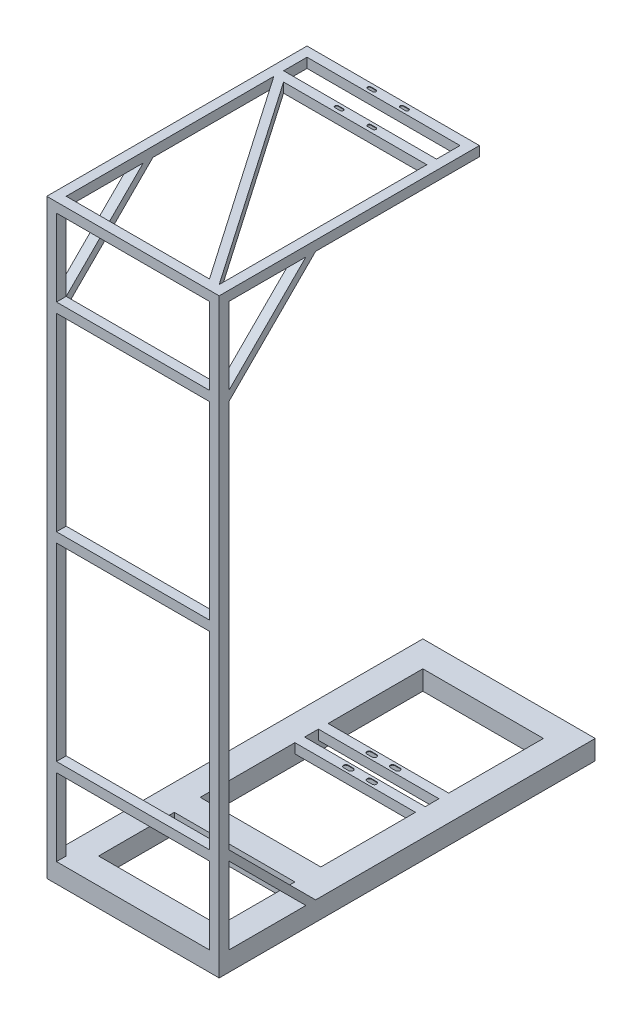
from build123d import *

# Parameters (mm, degrees)
SKETCH2_W             = 50.8
SKETCH2_H             = 38.1
SKETCH2_W_2           = 48.4
SKETCH2_H_2           = 35.7
SKETCH5_W             = 19.05
SKETCH5_H             = 19.05
SKETCH5_W_2           = 16.65
SKETCH5_H_2           = 16.65
SKETCH3_10_W          = 236.4
SKETCH3_10_H          = 27
CUT_EXTRUDE1_DEPTH    = 19.05
SKETCH13_W            = 50.8
SKETCH13_H            = 38.1
SKETCH13_W_2          = 48.4
SKETCH13_H_2          = 35.7
SKETCH15_W            = 19.05
SKETCH15_H            = 19.05
SKETCH15_W_2          = 16.65
SKETCH15_H_2          = 16.65
SKETCH18_W            = 19.05
SKETCH18_H            = 19.05
SKETCH18_W_2          = 16.65
SKETCH18_H_2          = 16.65
SWEEP11_START         = 23.05
SWEEP11_OUTLINE_W     = 299.9
SWEEP11_OUTLINE_H     = 1.2
SWEEP11_DEPTH         = 19.05
SWEEP11_START_2       = 40.9
SWEEP11_2_OUTLINE_W   = 299.9
SWEEP11_2_OUTLINE_H   = 16.65
SWEEP11_2_OUTLINE_W_2 = 16.65
SWEEP11_2_DEPTH       = 1.2
SWEEP11_3_OUTLINE_W   = 299.9
SWEEP11_3_OUTLINE_H   = 16.65
SWEEP11_3_DEPTH       = 1.2
CUT_EXTRUDE3_DEPTH    = 19.05
SWEEP12_START         = 149.95
SWEEP12_DEPTH         = 19.05
SKETCH23_W            = 19.05
SKETCH23_H            = 19.05
SKETCH27_W            = 19.05
SKETCH27_H            = 19.05
MIRROR3_START         = 149.95
MIRROR3_COPY_1_DEPTH  = 19.05


# Read off the part's stored shape, not the designer's step: Sweep11, Sweep12
with BuildPart() as part:
    # Sweep1: sweep along a path in Sketch1
    with BuildLine(Plane(origin=(0, 0, 0), x_dir=(1, 0, 0), z_dir=(0, 1, 0))) as sweep1_path:
        Line((169, 269), (-169, 269))
        Line((-169, 269), (-169, -269))
        Line((-169, -269), (169, -269))
        Line((169, -269), (169, 269))
    # Sketch2 → Sweep1 (sweep)
    with BuildSketch(Plane.XY):
        with Locations((-143.6, 19.05)):
            Rectangle(SKETCH2_W, SKETCH2_H)
        with Locations((-143.6, 19.05)):
            Rectangle(SKETCH2_W_2, SKETCH2_H_2, mode=Mode.SUBTRACT)
    sweep(path=sweep1_path.line, transition=Transition.RIGHT)

    # Sweep4: sweep along a path in Sketch3
    with BuildLine(Plane(origin=(0, 38.1, 0), x_dir=(1, 0, 0), z_dir=(0, 1, 0))) as sweep4_path:
        Line((118.2, 13.5), (-118.2, 13.5))
        Line((-118.2, 13.5), (-118.2, -13.5))
        Line((-118.2, -13.5), (118.2, -13.5))
        Line((118.2, -13.5), (118.2, 13.5))
    # Sketch5 → Sweep4 (sweep)
    with BuildSketch(Plane.XY):
        with Locations((-127.725, 28.575)):
            Rectangle(SKETCH5_W, SKETCH5_H)
        with Locations((-127.725, 28.575)):
            Rectangle(SKETCH5_W_2, SKETCH5_H_2, mode=Mode.SUBTRACT)
    sweep(path=sweep4_path.line, transition=Transition.RIGHT)

    # Sketch3<10> → Cut-Extrude1 (cut)
    with BuildSketch(Plane(origin=(0, 38.1, 0), x_dir=(1, 0, 0), z_dir=(0, 1, 0))):
        Rectangle(SKETCH3_10_W, SKETCH3_10_H)
        with BuildLine():
            Line((-17.980970389, 18.480970389), (-27.980970389, 18.480970389))
            ThreePointArc((-27.980970389, 18.480970389), (-32.480970389, 22.980970389), (-27.980970389, 27.480970389))
            Line((-27.980970389, 27.480970389), (-17.980970389, 27.480970389))
            ThreePointArc((-17.980970389, 27.480970389), (-13.480970389, 22.980970389), (-17.980970389, 18.480970389))
        make_face()
        with BuildLine():
            Line((17.980970389, 27.480970389), (27.980970389, 27.480970389))
            ThreePointArc((27.980970389, 27.480970389), (32.480970389, 22.980970389), (27.980970389, 18.480970389))
            Line((27.980970389, 18.480970389), (17.980970389, 18.480970389))
            ThreePointArc((17.980970389, 18.480970389), (13.480970389, 22.980970389), (17.980970389, 27.480970389))
        make_face()
        with BuildLine():
            Line((17.980970389, -18.480970389), (27.980970389, -18.480970389))
            ThreePointArc((27.980970389, -18.480970389), (32.480970389, -22.980970389), (27.980970389, -27.480970389))
            Line((27.980970389, -27.480970389), (17.980970389, -27.480970389))
            ThreePointArc((17.980970389, -27.480970389), (13.480970389, -22.980970389), (17.980970389, -18.480970389))
        make_face()
        with BuildLine():
            Line((-17.980970389, -27.480970389), (-27.980970389, -27.480970389))
            ThreePointArc((-27.980970389, -27.480970389), (-32.480970389, -22.980970389), (-27.980970389, -18.480970389))
            Line((-27.980970389, -18.480970389), (-17.980970389, -18.480970389))
            ThreePointArc((-17.980970389, -18.480970389), (-13.480970389, -22.980970389), (-17.980970389, -27.480970389))
        make_face()
    extrude(amount=-CUT_EXTRUDE1_DEPTH, mode=Mode.SUBTRACT)

    # Sweep5: sweep along a path in Sketch12
    with BuildLine(Plane(origin=(0, 38.1, 0), x_dir=(1, 0, 0), z_dir=(0, 1, 0))) as sweep5_path:
        Line((-169, -218.2), (169, -218.2))
        Line((169, -218.2), (169, -468.2))
        Line((169, -468.2), (-169, -468.2))
        Line((-169, -468.2), (-169, -218.2))
    # Sketch13 → Sweep5 (sweep)
    with BuildSketch(Plane.XY.offset(269)):
        with Locations((-143.6, 19.05)):
            Rectangle(SKETCH13_W, SKETCH13_H)
        with Locations((-143.6, 19.05)):
            Rectangle(SKETCH13_W_2, SKETCH13_H_2, mode=Mode.SUBTRACT)
    sweep(path=sweep5_path.line, transition=Transition.RIGHT)

    # Sweep6: sweep along a path in Sketch14
    with BuildLine(Plane.XY.offset(468.2)) as sweep6_path:
        Line((-169, 19.05), (169, 19.05))
        Line((169, 19.05), (169, 1158.1))
        Line((169, 1158.1), (-169, 1158.1))
        Line((-169, 1158.1), (-169, 19.05))
    # Sketch15 → Sweep6 (sweep)
    with BuildSketch(Plane(origin=(0, 38.1, 0), x_dir=(1, 0, 0), z_dir=(0, 1, 0))):
        with Locations((-159.475, -458.675)):
            Rectangle(SKETCH15_W, SKETCH15_H)
        with Locations((-159.475, -458.675)):
            Rectangle(SKETCH15_W_2, SKETCH15_H_2, mode=Mode.SUBTRACT)
    sweep(path=sweep6_path.line, transition=Transition.RIGHT)

    # Sweep7: sweep along a path in Sketch16
    with BuildLine(Plane(origin=(0, 1158.1, 0), x_dir=(1, 0, 0), z_dir=(0, 1, 0))) as sweep7_path:
        Line((169, -468.2), (-169, -468.2))
        Line((-169, -468.2), (-169, 42))
        Line((-169, 42), (169, 42))
        Line((169, 42), (169, -468.2))
    # Sketch18 → Sweep7 (sweep)
    with BuildSketch(Plane.XY.offset(468.2)):
        with Locations((-159.475, 1148.575)):
            Rectangle(SKETCH18_W, SKETCH18_H)
        with Locations((-159.475, 1148.575)):
            Rectangle(SKETCH18_W_2, SKETCH18_H_2, mode=Mode.SUBTRACT)
    sweep(path=sweep7_path.line, transition=Transition.RIGHT)

    # Sweep11 outline → Sweep11 (add)
    with BuildSketch(Plane.XY.offset(SWEEP11_START)):
        with Locations((0, 1157.5)):
            Rectangle(SWEEP11_OUTLINE_W, SWEEP11_OUTLINE_H)
        with Locations((0, 1139.65)):
            Rectangle(SWEEP11_OUTLINE_W, SWEEP11_OUTLINE_H)
    extrude(amount=SWEEP11_DEPTH)

    # Sweep11 2 outline → Sweep11 2 (add)
    with BuildSketch(Plane.XY.offset(SWEEP11_START_2)):
        with Locations((0, 1148.575)):
            Rectangle(SWEEP11_2_OUTLINE_W, SWEEP11_2_OUTLINE_H)
        with Locations((-159.475, 1148.575)):
            Rectangle(SWEEP11_2_OUTLINE_W_2, SWEEP11_2_OUTLINE_H)
        with Locations((159.475, 1148.575)):
            Rectangle(SWEEP11_2_OUTLINE_W_2, SWEEP11_2_OUTLINE_H)
    extrude(amount=SWEEP11_2_DEPTH)

    # Sweep11 3 outline → Sweep11 3 (add)
    with BuildSketch(Plane.XY.offset(SWEEP11_START)):
        with Locations((0, 1148.575)):
            Rectangle(SWEEP11_3_OUTLINE_W, SWEEP11_3_OUTLINE_H)
    extrude(amount=SWEEP11_3_DEPTH)

    # Sketch16<4> → Cut-Extrude3 (cut)
    with BuildSketch(Plane(origin=(0, 1158.1, 0), x_dir=(1, 0, 0), z_dir=(0, 1, 0))):
        with BuildLine():
            Line((-27, 35.3), (-37, 35.3))
            ThreePointArc((-37, 35.3), (-40.3, 32), (-37, 28.7))
            Line((-37, 28.7), (-27, 28.7))
            ThreePointArc((-27, 28.7), (-23.7, 32), (-27, 35.3))
        make_face()
        with BuildLine():
            Line((27, 28.7), (37, 28.7))
            ThreePointArc((37, 28.7), (40.3, 32), (37, 35.3))
            Line((37, 35.3), (27, 35.3))
            ThreePointArc((27, 35.3), (23.7, 32), (27, 28.7))
        make_face()
        with BuildLine():
            Line((-27, -28.7), (-37, -28.7))
            ThreePointArc((-37, -28.7), (-40.3, -32), (-37, -35.3))
            Line((-37, -35.3), (-27, -35.3))
            ThreePointArc((-27, -35.3), (-23.7, -32), (-27, -28.7))
        make_face()
        with BuildLine():
            Line((27, -35.3), (37, -35.3))
            ThreePointArc((37, -35.3), (40.3, -32), (37, -28.7))
            Line((37, -28.7), (27, -28.7))
            ThreePointArc((27, -28.7), (23.7, -32), (27, -35.3))
        make_face()
    extrude(amount=-CUT_EXTRUDE3_DEPTH, mode=Mode.SUBTRACT)

    # Sweep12 outline → Sweep12 (add)
    with BuildSketch(Plane.YZ.offset(SWEEP12_START)):
        Polygon((969.05, 449.15), (1139.05, 279.15), (1139.05, 298.2), (988.1, 449.15), align=None)
    sweep12 = extrude(amount=SWEEP12_DEPTH)

    # Mirror2: Sweep12 across plane
    add(sweep12.mirror(Plane.ZY))

    # Sweep17: sweep along a path in Sketch25
    with BuildLine(Plane(origin=(0, 1158.1, 0), x_dir=(1, 0, 0), z_dir=(0, 1, 0))) as sweep17_path:
        Line((-130.9, -42.1), (149.95, -449.15))
    # Sketch23 → Sweep17 (sweep)
    with BuildSketch(Plane.XY.offset(42.1)):
        with Locations((-140.425, 1148.575)):
            Rectangle(SKETCH23_W, SKETCH23_H)
    sweep(path=sweep17_path.line)

    # Sweep18: sweep along a path in Sketch26
    with BuildLine(Plane.XY.offset(468.2)) as sweep18_path:
        Line((-149.95, 588.575), (159.475, 588.575))
        Line((159.475, 588.575), (159.475, 978.575))
        Line((159.475, 978.575), (-149.95, 978.575))
    # Sketch27 → Sweep18 (sweep)
    with BuildSketch(Plane.ZY.offset(-149.95)):
        with Locations((458.675, 588.575)):
            Rectangle(SKETCH27_W, SKETCH27_H)
    sweep18 = sweep(path=sweep18_path.line, transition=Transition.RIGHT)

    # Mirror3: Sweep12, Sweep18 across plane
    add(sweep12.mirror(Plane(origin=(0, 588.575, 0), x_dir=(0, 0, 1), z_dir=(0, -1, 0))))
    add(sweep18.mirror(Plane(origin=(0, 588.575, 0), x_dir=(0, 0, 1), z_dir=(0, -1, 0))))

    # Mirror3 copy 1 sketch → Mirror3 copy 1 (add)
    with BuildSketch(Plane(origin=(0, 1177.15, 0), x_dir=(0, -1, 0), z_dir=(-1, 0, 0)).offset(MIRROR3_START)):
        Polygon((969.05, 449.15), (1139.05, 279.15), (1139.05, 298.2), (988.1, 449.15), align=None)
    extrude(amount=MIRROR3_COPY_1_DEPTH)


solid = part.part
